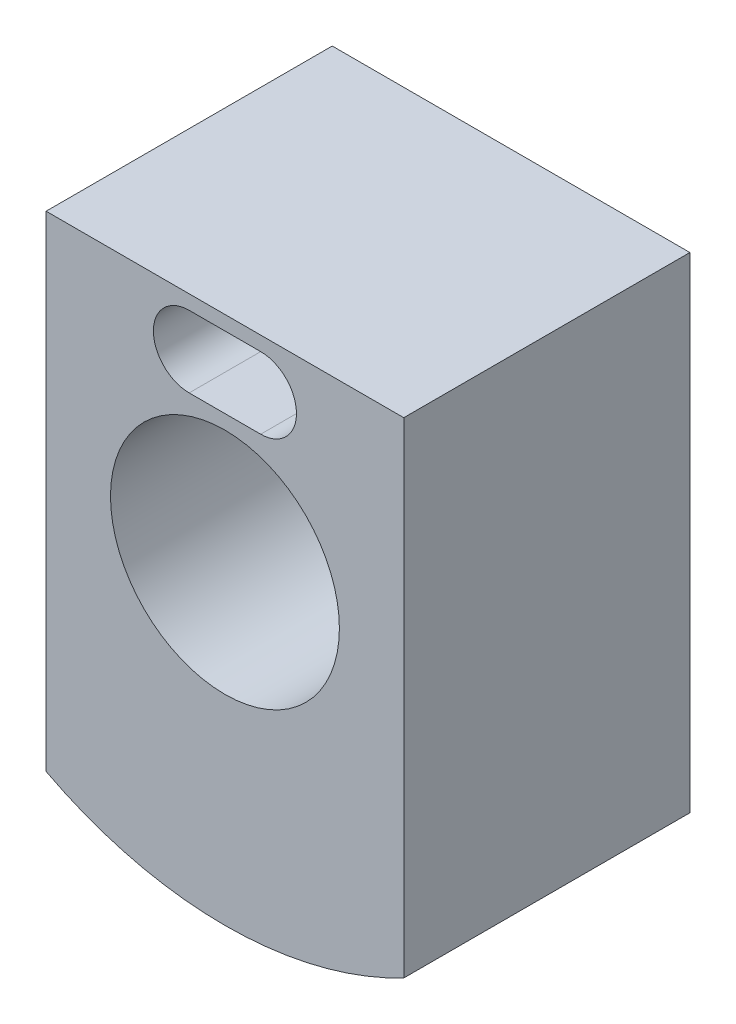
from build123d import *

# Parameters (mm, degrees)
BOSS_EXTRUDE2_DEPTH     = 40
CUT_EXTRUDE1_DEPTH      = 72.681940717
CUT_EXTRUDE1_DEPTH_BACK = 72.681940717
SKETCH2_R               = 16
CUT_EXTRUDE3_DEPTH      = 72.681940717


with BuildPart() as part:
    # Sketch1 → Boss-Extrude2 (new body)
    with BuildSketch(Plane.XY):
        with BuildLine():
            Line((-25, 0), (-25, -47.83618531))
            ThreePointArc((-25, -47.83618531), (0, -53.975), (25, -47.83618531))
            Line((25, -47.83618531), (25, 0))
            Line((25, 0), (25, 20))
            Line((25, 20), (-25, 20))
            Line((-25, 20), (-25, 0))
        make_face()
    extrude(amount=BOSS_EXTRUDE2_DEPTH)

    # Sketch2 → Cut-Extrude1 (cut, two sides: drawn at the far end of the back side and taken through both)
    with BuildSketch(Plane.XY.offset(40).offset(-CUT_EXTRUDE1_DEPTH_BACK)):
        with Locations((0, -10)):
            Circle(SKETCH2_R)
    extrude(amount=CUT_EXTRUDE1_DEPTH + CUT_EXTRUDE1_DEPTH_BACK, mode=Mode.SUBTRACT)

    # Sketch4 → Cut-Extrude3 (cut, through all)
    with BuildSketch(Plane.XY.offset(40)):
        with BuildLine():
            Line((-5, 18), (5, 18))
            ThreePointArc((5, 18), (10, 13), (5, 8))
            Line((5, 8), (-5, 8))
            ThreePointArc((-5, 8), (-10, 13), (-5, 18))
        make_face()
    extrude(amount=-CUT_EXTRUDE3_DEPTH, mode=Mode.SUBTRACT)


solid = part.part
